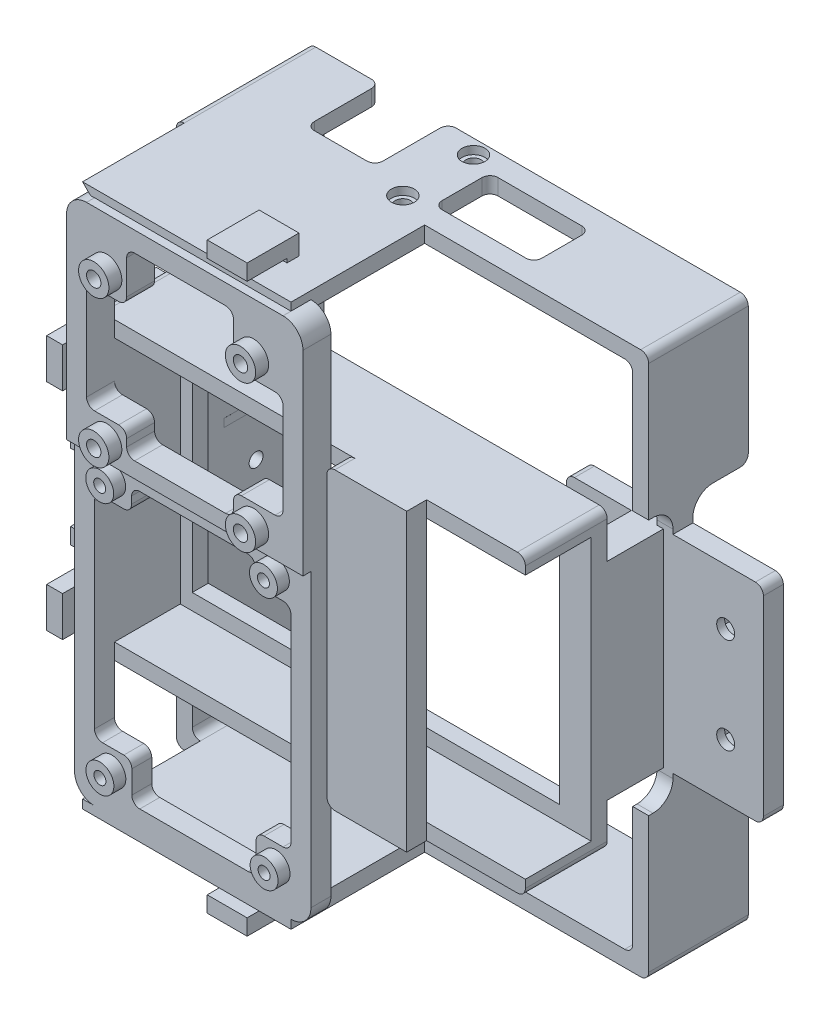
from build123d import *

# Parameters (mm, degrees)
BOSS_EXTRUDE1_DEPTH      = 3.695048
BOSS_EXTRUDE1_DEPTH_BACK = 21.278005
SKETCH1_W                = 0.01
SKETCH1_H                = 2
SKETCH3_W                = 24.973053222
SKETCH3_H                = 128.156000146
BOSS_EXTRUDE2_DEPTH      = 4
SKETCH4_R                = 1.9
SKETCH4_W                = 25
SKETCH4_H                = 14
BOSS_EXTRUDE3_DEPTH      = 4
BOSS_EXTRUDE4_START      = 4
SKETCH8_R                = 1.9
SKETCH8_W                = 25
SKETCH8_H                = 14
BOSS_EXTRUDE4_DEPTH      = 4
BOSS_EXTRUDE5_DEPTH      = 24.973053221
BOSS_EXTRUDE6_START      = 0.5
BOSS_EXTRUDE6_DEPTH      = 5
FILLET2_R                = 5
FILLET3_R                = 5
FILLET4_R                = 5
FILLET5_R                = 5
FILLET6_R                = 2
FILLET7_R                = 2
FILLET8_R                = 2
FILLET9_R                = 2
SKETCH11_R               = 2.25
CUT_EXTRUDE1_DEPTH       = 5
CUT_EXTRUDE2_DEPTH       = 3
SKETCH14_R               = 1.75
CUT_EXTRUDE6_DEPTH       = 4
SKETCH15_R               = 2.875
CUT_EXTRUDE7_DEPTH       = 2
CUT_EXTRUDE8_START       = -2
SKETCH16_R               = 2.875
CUT_EXTRUDE8_DEPTH       = 2
BOSS_EXTRUDE7_START      = 8
BOSS_EXTRUDE7_DEPTH      = 8
BOSS_EXTRUDE8_DEPTH      = 28.5
SKETCH19_W               = 52.25
SKETCH19_H               = 2.188820213
BOSS_EXTRUDE9_DEPTH      = 5
SKETCH20_W               = 8
SKETCH20_H               = 51.865848188
BOSS_EXTRUDE10_DEPTH     = 14.086526611
BOSS_EXTRUDE11_DEPTH     = 10
BOSS_EXTRUDE12_DEPTH     = 4
CUT_EXTRUDE11_START      = -1
SKETCH25_W               = 2
SKETCH25_H               = 19.5
CUT_EXTRUDE11_DEPTH      = 47.5
JOIN1_START              = 11.695048456
JOIN1_DEPTH              = 20.5
JOIN1_START_2            = 32.195048456
JOIN1_2_DEPTH            = 5
JOIN1_3_OUTLINE_W        = 103
JOIN1_3_OUTLINE_H        = 66
JOIN1_3_OUTLINE_W_2      = 42
JOIN1_3_OUTLINE_H_2      = 58
JOIN1_3_DEPTH            = 4
JOIN1_START_3            = 35.195048456
JOIN1_4_OUTLINE_R        = 3.5
JOIN1_4_OUTLINE_R_2      = 1.5
JOIN1_4_DEPTH            = 4
JOIN1_START_4            = 37.195048456
JOIN1_5_OUTLINE_R        = 3.800000663
JOIN1_5_OUTLINE_R_2      = 1.800000663
JOIN1_5_DEPTH            = 5.25
JOIN1_START_5            = 39.195048456
JOIN1_6_OUTLINE_R        = 3.5
JOIN1_6_OUTLINE_R_2      = 1.5
JOIN1_6_DEPTH            = 1
SKETCH26_W               = 3
SKETCH26_H               = 10
BOSS_EXTRUDE13_DEPTH     = 5
SKETCH27_W               = 4
SKETCH27_H               = 10
BOSS_EXTRUDE14_DEPTH     = 10
SKETCH28_W               = 10
SKETCH28_H               = 3
BOSS_EXTRUDE15_DEPTH     = 5
SKETCH29_W               = 10
SKETCH29_H               = 3
BOSS_EXTRUDE16_DEPTH     = 5
SKETCH30_W               = 10
SKETCH30_H               = 4
BOSS_EXTRUDE17_DEPTH     = 10


# Read off the part's stored shape, not the designer's step: Join1
with BuildPart() as part:
    # Sketch1 → Boss-Extrude1 (new, two sides: drawn at the far end of the back side and taken through both)
    with BuildSketch(Plane.XY.offset(-BOSS_EXTRUDE1_DEPTH_BACK)):
        with Locations((81.095003321, 0.501)):
            Rectangle(SKETCH1_W, SKETCH1_H)
    extrude(amount=BOSS_EXTRUDE1_DEPTH + BOSS_EXTRUDE1_DEPTH_BACK)

    # Sketch3 → Boss-Extrude2 (add)
    with BuildSketch(Plane.ZY.offset(-81.090003321)):
        with Locations((-8.791478155, 0.501)):
            Rectangle(SKETCH3_W, SKETCH3_H)
    extrude(amount=BOSS_EXTRUDE2_DEPTH)

    # Sketch4 → Boss-Extrude3 (add)
    with BuildSketch(Plane.XZ.offset(63.577000073)):
        Polygon((77.090003321, -21.278004766), (77.090003321, 3.695048456), (171.572794191, 3.695048456), (171.572794191, -21.278004766), (112.241426774, -21.278004766), (112.241426774, -2.941478155), (95.058571688, -2.941478155), (95.058571688, -21.278004766), align=None)
        with Locations((122.241426774, 0.058521845)):
            Circle(SKETCH4_R, mode=Mode.SUBTRACT)
        with Locations((122.241426774, -17.641478155)):
            Circle(SKETCH4_R, mode=Mode.SUBTRACT)
        with Locations((140.741426774, -8.791478155)):
            Rectangle(SKETCH4_W, SKETCH4_H, mode=Mode.SUBTRACT)
    extrude(amount=BOSS_EXTRUDE3_DEPTH)

    # Sketch8 → Boss-Extrude4 (add)
    with BuildSketch(Plane(origin=(0, 64.579000073, 0), x_dir=(1, 0, 0), z_dir=(0, 1, 0)).offset(BOSS_EXTRUDE4_START)):
        Polygon((95.058571688, 21.278004766), (77.090003321, 21.278004766), (77.090003321, -3.695048456), (171.572794191, -3.695048456), (171.572794191, 21.278004766), (112.241426774, 21.278004766), (112.241426774, 2.941478155), (95.058571688, 2.941478155), align=None)
        with Locations((122.241426774, 17.641478155)):
            Circle(SKETCH8_R, mode=Mode.SUBTRACT)
        with Locations((122.241426774, -0.058521845)):
            Circle(SKETCH8_R, mode=Mode.SUBTRACT)
        with Locations((140.741426774, 8.791478155)):
            Rectangle(SKETCH8_W, SKETCH8_H, mode=Mode.SUBTRACT)
    extrude(amount=-BOSS_EXTRUDE4_DEPTH)

    # Sketch9 → Boss-Extrude5 (add)
    with BuildSketch(Plane.XY.offset(3.695048456)):
        Polygon((171.572794191, -67.577000073), (187.487825359, -67.577000073), (187.487825359, -31.577000073), (183.487825359, -31.577000073), (183.487825359, -63.577000073), (171.572794191, -63.577000073), align=None)
        Polygon((183.487825359, 32.579000073), (187.487825359, 32.579000073), (187.487825359, 68.579000073), (171.572794191, 68.579000073), (171.572794191, 64.579000073), (183.487825359, 64.579000073), align=None)
    extrude(amount=-BOSS_EXTRUDE5_DEPTH)

    # Sketch10 → Boss-Extrude6 (add)
    with BuildSketch(Plane.XY.offset(-7.891478155).offset(BOSS_EXTRUDE6_START)):
        Polygon((160.809135524, -25.431924094), (160.809135524, 26.433924094), (183.487825359, 26.433924094), (183.487825359, 32.579000073), (187.487825359, 32.579000073), (187.487825359, 26.433924094), (210.166515194, 26.433924094), (210.166515194, -25.431924094), (187.487825359, -25.431924094), (187.487825359, -31.577000073), (183.487825359, -31.577000073), (183.487825359, -25.431924094), align=None)
    extrude(amount=BOSS_EXTRUDE6_DEPTH)

    # Fillet2
    fillet2_edges = [part.edges().sort_by_distance(p)[0] for p in [
        (185.487825359, -31.577000073, -2.391478155),
    ]]
    fillet(fillet2_edges, radius=FILLET2_R)

    # Fillet3
    fillet3_edges = [part.edges().sort_by_distance(p)[0] for p in [
        (185.487825359, -31.577000073, -7.391478155),
    ]]
    fillet(fillet3_edges, radius=FILLET3_R)

    # Fillet4
    fillet4_edges = [part.edges().sort_by_distance(p)[0] for p in [
        (185.487825359, 32.579000073, -7.391478155),
    ]]
    fillet(fillet4_edges, radius=FILLET4_R)

    # Fillet5
    fillet5_edges = [part.edges().sort_by_distance(p)[0] for p in [
        (185.487825359, 32.579000073, -2.391478155),
    ]]
    fillet(fillet5_edges, radius=FILLET5_R)

    # Fillet6
    fillet6_edges = [part.edges().sort_by_distance(p)[0] for p in [
        (160.809135524, -25.431924094, -4.891478155),
        (210.166515194, -25.431924094, -4.891478155),
        (210.166515194, 26.433924094, -4.891478155),
        (160.809135524, 26.433924094, -4.891478155),
    ]]
    fillet(fillet6_edges, radius=FILLET6_R)

    # Fillet7
    fillet7_edges = [part.edges().sort_by_distance(p)[0] for p in [
        (187.487825359, -67.577000073, -8.791478155),
        (185.487825359, -31.577000073, -21.278004765),
        (187.487825359, 68.579000073, -8.791478155),
        (185.487825359, 32.579000073, -21.278004765),
    ]]
    fillet(fillet7_edges, radius=FILLET7_R)

    # Fillet8
    fillet8_edges = [part.edges().sort_by_distance(p)[0] for p in [
        (183.487825359, -63.577000073, -8.791478155),
        (183.487825359, 64.579000073, -8.791478155),
        (81.090003321, 64.579000073, -8.791478155),
        (81.090003321, -63.577000073, -8.791478155),
        (77.090003321, -67.577000073, -8.791478155),
        (77.090003321, 68.579000073, -8.791478155),
    ]]
    fillet(fillet8_edges, radius=FILLET8_R)

    # Fillet9
    fillet9_edges = [part.edges().sort_by_distance(p)[0] for p in [
        (95.058571688, -65.577000073, -21.278004766),
        (95.058571688, -65.577000073, -2.941478155),
        (112.241426774, -65.577000073, -2.941478155),
        (112.241426774, -65.577000073, -21.278004766),
        (128.241426774, -65.577000073, -1.791478155),
        (128.241426774, -65.577000073, -15.791478155),
        (153.241426774, -65.577000073, -15.791478155),
        (153.241426774, -65.577000073, -1.791478155),
        (112.241426774, 66.579000073, -21.278004766),
        (112.241426774, 66.579000073, -2.941478155),
        (95.058571688, 66.579000073, -2.941478155),
        (95.058571688, 66.579000073, -21.278004766),
        (153.241426774, 66.579000073, -1.791478155),
        (153.241426774, 66.579000073, -15.791478155),
        (128.241426774, 66.579000073, -15.791478155),
        (128.241426774, 66.579000073, -1.791478155),
    ]]
    fillet(fillet9_edges, radius=FILLET9_R)

    # Sketch11 → Cut-Extrude1 (cut)
    with BuildSketch(Plane.XY.offset(-2.391478155)):
        with Locations((170.268989638, -11.499)):
            Circle(SKETCH11_R)
        with Locations((170.268989638, 12.501)):
            Circle(SKETCH11_R)
        with Locations((200.706661081, -11.499)):
            Circle(SKETCH11_R)
        with Locations((200.706661081, 12.501)):
            Circle(SKETCH11_R)
    extrude(amount=-CUT_EXTRUDE1_DEPTH, mode=Mode.SUBTRACT)

    # Sketch12 → Cut-Extrude2 (cut)
    with BuildSketch(Plane(origin=(0, 0, -7.391478155), x_dir=(-1, 0, 0), z_dir=(0, 0, -1))):
        Polygon((-203.356661081, -13.028978213), (-203.356661081, -9.969021787), (-200.706661081, -8.439043573), (-198.056661081, -9.969021787), (-198.056661081, -13.028978213), (-200.706661081, -14.558956427), align=None)
        Polygon((-203.356661081, 10.971021787), (-203.356661081, 14.030978213), (-200.706661081, 15.560956427), (-198.056661081, 14.030978213), (-198.056661081, 10.971021787), (-200.706661081, 9.441043573), align=None)
        Polygon((-172.918989638, -13.028978213), (-172.918989638, -9.969021787), (-170.268989638, -8.439043573), (-167.618989638, -9.969021787), (-167.618989638, -13.028978213), (-170.268989638, -14.558956427), align=None)
        Polygon((-172.918989638, 10.971021787), (-172.918989638, 14.030978213), (-170.268989638, 15.560956427), (-167.618989638, 14.030978213), (-167.618989638, 10.971021787), (-170.268989638, 9.441043573), align=None)
    extrude(amount=-CUT_EXTRUDE2_DEPTH, mode=Mode.SUBTRACT)

    # Sketch14 → Cut-Extrude6 (cut)
    with BuildSketch(Plane.ZY.offset(-77.090003321)):
        with Locations(Location((-15.304951544, -11.499, 0), (0, 0, 270))):
            Circle(SKETCH14_R)
        with Locations(Location((-15.304951544, 12.501, 0), (0, 0, 270))):
            Circle(SKETCH14_R)
        with Locations(Location((-4.304951544, -11.499, 0), (0, 0, 270))):
            Circle(SKETCH14_R)
        with Locations(Location((-4.304951544, 12.501, 0), (0, 0, 270))):
            Circle(SKETCH14_R)
    extrude(amount=-CUT_EXTRUDE6_DEPTH, mode=Mode.SUBTRACT)

    # Sketch15 → Cut-Extrude7 (cut)
    with BuildSketch(Plane.XZ.offset(67.577000073)):
        with Locations((122.241426774, 0.058521845)):
            Circle(SKETCH15_R)
        with Locations((122.241426774, -17.641478155)):
            Circle(SKETCH15_R)
    extrude(amount=-CUT_EXTRUDE7_DEPTH, mode=Mode.SUBTRACT)

    # Sketch16 → Cut-Extrude8 (cut)
    with BuildSketch(Plane(origin=(0, 68.579000073, 0), x_dir=(1, 0, 0), z_dir=(0, 1, 0)).offset(CUT_EXTRUDE8_START)):
        with Locations((122.241426774, 17.641478155)):
            Circle(SKETCH16_R)
        with Locations((122.241426774, -0.058521845)):
            Circle(SKETCH16_R)
    extrude(amount=CUT_EXTRUDE8_DEPTH, mode=Mode.SUBTRACT)

    # Sketch17 → Boss-Extrude7 (add)
    with BuildSketch(Plane.XY.offset(3.695048456).offset(BOSS_EXTRUDE7_START)):
        with BuildLine():
            Line((83.090003321, -63.577000073), (79.090003321, -67.577000073))
            ThreePointArc((79.090003321, -67.577000073), (77.675789759, -66.991213635), (77.090003321, -65.577000073))
            Line((77.090003321, -65.577000073), (77.090003321, 66.579000073))
            ThreePointArc((77.090003321, 66.579000073), (77.675789759, 67.993213635), (79.090003321, 68.579000073))
            Line((79.090003321, 68.579000073), (83.090003321, 64.579000073))
            ThreePointArc((83.090003321, 64.579000073), (81.675789759, 63.993213635), (81.090003321, 62.579000073))
            Line((81.090003321, 62.579000073), (81.090003321, 1.501))
            Line((81.090003321, 1.501), (81.090003321, -0.499))
            Line((81.090003321, -0.499), (81.090003321, -61.577000073))
            ThreePointArc((81.090003321, -61.577000073), (81.675789759, -62.991213635), (83.090003321, -63.577000073))
        make_face()
    extrude(amount=-BOSS_EXTRUDE7_DEPTH)

    # Sketch18 → Boss-Extrude8 (add)
    with BuildSketch(Plane.XY.offset(3.695048456)):
        Polygon((131.340003321, 68.579000073), (131.340003321, 64.579000073), (83.090003321, 64.579000073), (79.090003321, 68.579000073), align=None)
        Polygon((79.090003321, -67.577000073), (83.090003321, -63.577000073), (131.340003321, -63.577000073), (131.340003321, -67.577000073), align=None)
    extrude(amount=BOSS_EXTRUDE8_DEPTH)

    # Sketch19 → Boss-Extrude9 (add)
    with BuildSketch(Plane.XY.offset(32.195048456)):
        Polygon((131.340003321, 68.579000073), (79.090003321, 68.579000073), (81.090003321, 66.579000073), (131.340003321, 66.579000073), align=None)
        with Locations((105.215003321, -66.482589967)):
            Rectangle(SKETCH19_W, SKETCH19_H)
    extrude(amount=BOSS_EXTRUDE9_DEPTH)

    # Sketch20 → Boss-Extrude10 (add)
    with BuildSketch(Plane.XY.offset(-2.391478155)):
        with Locations((181.090003321, 0.501)):
            Rectangle(SKETCH20_W, SKETCH20_H)
    extrude(amount=BOSS_EXTRUDE10_DEPTH)

    # Sketch21 → Boss-Extrude11 (add)
    with BuildSketch(Plane.ZY.offset(-77.090003321)):
        Polygon((2.695048456, 24.75), (2.695048456, -24.75), (24.195048456, -24.75), (24.195048456, -23.75), (24.195048456, -22.75), (4.695048456, -22.75), (4.695048456, 22.75), (24.195048456, 22.75), (24.195048456, 23.75), (24.195048456, 24.75), align=None)
    extrude(amount=BOSS_EXTRUDE11_DEPTH)

    # Sketch22 → Boss-Extrude12 (add)
    with BuildSketch(Plane.ZY.offset(-67.090003321)):
        with BuildLine():
            Line((24.195048456, -24.75), (2.695048456, -24.75))
            Line((2.695048456, -24.75), (2.695048456, 24.75))
            Line((2.695048456, 24.75), (24.195048456, 24.75))
            Line((24.195048456, 24.75), (24.195048456, 20.75))
            Line((24.195048456, 20.75), (15.195048456, 20.75))
            ThreePointArc((15.195048456, 20.75), (6.695048456, 12.25), (15.195048456, 3.75))
            Line((15.195048456, 3.75), (24.195048456, 3.75))
            Line((24.195048456, 3.75), (24.195048456, -3.75))
            Line((24.195048456, -3.75), (15.195048456, -3.75))
            ThreePointArc((15.195048456, -3.75), (6.695048456, -12.25), (15.195048456, -20.75))
            Line((15.195048456, -20.75), (24.195048456, -20.75))
            Line((24.195048456, -20.75), (24.195048456, -24.75))
        make_face()
    extrude(amount=BOSS_EXTRUDE12_DEPTH)

    # Sketch25 → Cut-Extrude11 (cut)
    with BuildSketch(Plane.XZ.offset(-22.75).offset(CUT_EXTRUDE11_START)):
        with Locations((71.090003321, 14.445048456)):
            Rectangle(SKETCH25_W, SKETCH25_H)
    extrude(amount=CUT_EXTRUDE11_DEPTH, mode=Mode.SUBTRACT)

    # Join1 outline → Join1 (add)
    with BuildSketch(Plane.XY.offset(JOIN1_START)):
        with BuildLine():
            ThreePointArc((77.090003321, -34.32267986), (77.675789759, -35.736893422), (79.090003321, -36.32267986))
            Line((79.090003321, -36.32267986), (183.090003321, -36.32267986))
            ThreePointArc((183.090003321, -36.32267986), (184.504216883, -35.736893422), (185.090003321, -34.32267986))
            Line((185.090003321, -34.32267986), (185.090003321, -32.32267986))
            Line((185.090003321, -32.32267986), (82.090003321, -32.32267986))
            Line((82.090003321, -32.32267986), (82.090003321, 33.67732014))
            Line((82.090003321, 33.67732014), (185.090003321, 33.67732014))
            Line((185.090003321, 33.67732014), (185.090003321, 35.67732014))
            ThreePointArc((185.090003321, 35.67732014), (184.504216884, 37.091533703), (183.090003321, 37.67732014))
            Line((183.090003321, 37.67732014), (79.090003321, 37.67732014))
            ThreePointArc((79.090003321, 37.67732014), (77.675789759, 37.091533703), (77.090003321, 35.67732014))
            Line((77.090003321, 35.67732014), (77.090003321, -34.32267986))
        make_face()
    extrude(amount=JOIN1_DEPTH)

    # Join1 2 outline → Join1 2 (add)
    # profile 1 of 2: a face of its own
    with BuildSketch(Plane.XY.offset(JOIN1_START_2)):
        with BuildLine():
            ThreePointArc((77.090003321, -60.38817986), (78.554469415, -63.923713766), (82.090003321, -65.38817986))
            Line((82.090003321, -65.38817986), (131.340003321, -65.38817986))
            ThreePointArc((131.340003321, -65.38817986), (134.875537227, -63.923713766), (136.340003321, -60.38817986))
            Line((136.340003321, -60.38817986), (136.340003321, 61.61182014))
            ThreePointArc((136.340003321, 61.61182014), (134.875537227, 65.147354046), (131.340003321, 66.61182014))
            Line((131.340003321, 66.61182014), (82.090003321, 66.61182014))
            ThreePointArc((82.090003321, 66.61182014), (81.803559317, 66.60360838), (81.518056196, 66.579000073))
            ThreePointArc((81.518056196, 66.579000073), (78.357729508, 64.939000957), (77.090003321, 61.61182014))
            Line((77.090003321, 61.61182014), (77.090003321, -60.38817986))
        make_face()
        with BuildLine():
            Line((82.090003321, -48.68817986), (82.090003321, 0.74282014))
            ThreePointArc((82.090003321, 0.74282014), (82.675789759, 2.157033703), (84.090003321, 2.74282014))
            Line((84.090003321, 2.74282014), (89.392003321, 2.74282014))
            ThreePointArc((89.392003321, 2.74282014), (90.806216883, 3.328606578), (91.392003321, 4.74282014))
            Line((91.392003321, 4.74282014), (91.392003321, 6.525000079))
            ThreePointArc((91.392003321, 6.525000079), (91.977789759, 7.939213642), (93.392003321, 8.525000079))
            Line((93.392003321, 8.525000079), (120.434003321, 8.525000079))
            ThreePointArc((120.434003321, 8.525000079), (121.848216884, 7.939213642), (122.434003321, 6.525000079))
            Line((122.434003321, 6.525000079), (122.434003321, 4.70582014))
            ThreePointArc((122.434003321, 4.70582014), (123.019789759, 3.291606578), (124.434003321, 2.70582014))
            Line((124.434003321, 2.70582014), (129.340003321, 2.70582014))
            ThreePointArc((129.340003321, 2.70582014), (130.754216884, 2.120033703), (131.340003321, 0.70582014))
            Line((131.340003321, 0.70582014), (131.340003321, -48.68817986))
            ThreePointArc((131.340003321, -48.68817986), (130.754216883, -50.102393422), (129.340003321, -50.68817986))
            Line((129.340003321, -50.68817986), (124.590003321, -50.68817986))
            ThreePointArc((124.590003321, -50.68817986), (123.175789759, -51.273966298), (122.590003321, -52.68817986))
            Line((122.590003321, -52.68817986), (122.590003321, -58.38817986))
            ThreePointArc((122.590003321, -58.38817986), (122.004216883, -59.802393423), (120.590003321, -60.38817986))
            Line((120.590003321, -60.38817986), (93.440003321, -60.38817986))
            ThreePointArc((93.440003321, -60.38817986), (92.025789759, -59.802393422), (91.440003321, -58.38817986))
            Line((91.440003321, -58.38817986), (91.440003321, -52.68817986))
            ThreePointArc((91.440003321, -52.68817986), (90.854216884, -51.273966297), (89.440003321, -50.68817986))
            Line((89.440003321, -50.68817986), (84.090003321, -50.68817986))
            ThreePointArc((84.090003321, -50.68817986), (82.675789759, -50.102393422), (82.090003321, -48.68817986))
        make_face(mode=Mode.SUBTRACT)
        Polygon((89.315003321, -54.028297836), (89.315003321, -57.348061884), (86.440003321, -59.007943908), (83.565003321, -57.348061884), (83.565003321, -54.028297836), (86.440003321, -52.368415812), align=None, mode=Mode.SUBTRACT)
        Polygon((127.590003321, -52.368415812), (130.465003321, -54.028297836), (130.465003321, -57.348061884), (127.590003321, -59.007943908), (124.715003321, -57.348061884), (124.715003321, -54.028297836), align=None, mode=Mode.SUBTRACT)
        with BuildLine():
            ThreePointArc((82.090003321, 47.11182014), (82.675789759, 48.526033703), (84.090003321, 49.11182014))
            Line((84.090003321, 49.11182014), (90.144627644, 49.11182014))
            ThreePointArc((90.144627644, 49.11182014), (91.558841207, 49.697606577), (92.144627644, 51.11182014))
            Line((92.144627644, 51.11182014), (92.144627644, 59.61182014))
            ThreePointArc((92.144627644, 59.61182014), (92.730414082, 61.026033703), (94.144627644, 61.61182014))
            Line((94.144627644, 61.61182014), (116.934003321, 61.61182014))
            ThreePointArc((116.934003321, 61.61182014), (118.348216884, 61.026033703), (118.934003321, 59.61182014))
            Line((118.934003321, 59.61182014), (118.934003321, 51.11182014))
            ThreePointArc((118.934003321, 51.11182014), (119.519789759, 49.697606578), (120.934003321, 49.11182014))
            Line((120.934003321, 49.11182014), (129.340003321, 49.11182014))
            ThreePointArc((129.340003321, 49.11182014), (130.754216884, 48.526033703), (131.340003321, 47.11182014))
            Line((131.340003321, 47.11182014), (131.340003321, 24.344180019))
            ThreePointArc((131.340003321, 24.344180019), (130.754216884, 22.929966456), (129.340003321, 22.344180019))
            Line((129.340003321, 22.344180019), (120.934003321, 22.344180019))
            ThreePointArc((120.934003321, 22.344180019), (119.519789759, 21.758393581), (118.934003321, 20.344180019))
            Line((118.934003321, 20.344180019), (118.934003321, 18.525000079))
            ThreePointArc((118.934003321, 18.525000079), (118.348216884, 17.110786517), (116.934003321, 16.525000079))
            Line((116.934003321, 16.525000079), (94.144627644, 16.525000079))
            ThreePointArc((94.144627644, 16.525000079), (92.730414082, 17.110786517), (92.144627644, 18.525000079))
            Line((92.144627644, 18.525000079), (92.144627644, 20.344180019))
            ThreePointArc((92.144627644, 20.344180019), (91.558841207, 21.758393582), (90.144627644, 22.344180019))
            Line((90.144627644, 22.344180019), (84.090003321, 22.344180019))
            ThreePointArc((84.090003321, 22.344180019), (82.675789759, 22.929966456), (82.090003321, 24.344180019))
            Line((82.090003321, 24.344180019), (82.090003321, 47.11182014))
        make_face(mode=Mode.SUBTRACT)
        Polygon((83.517003321, 9.402702164), (86.392003321, 11.062584188), (89.267003321, 9.402702164), (89.267003321, 6.082938116), (86.392003321, 4.423056092), (83.517003321, 6.082938116), align=None, mode=Mode.SUBTRACT)
        Polygon((127.434003321, 11.025584188), (130.309003321, 9.365702164), (130.309003321, 6.045938116), (127.434003321, 4.386056092), (124.559003321, 6.045938116), (124.559003321, 9.365702164), align=None, mode=Mode.SUBTRACT)
        Polygon((126.584003321, 55.641798354), (126.584003321, 52.581841927), (123.934003321, 51.051863713), (121.284003321, 52.581841927), (121.284003321, 55.641798354), (123.934003321, 57.171776567), align=None, mode=Mode.SUBTRACT)
        Polygon((84.494627644, 55.641798354), (87.144627644, 57.171776567), (89.794627644, 55.641798354), (89.794627644, 52.581841927), (87.144627644, 51.051863713), (84.494627644, 52.581841927), align=None, mode=Mode.SUBTRACT)
        Polygon((84.494627644, 18.874158232), (87.144627644, 20.404136445), (89.794627644, 18.874158232), (89.794627644, 15.814201805), (87.144627644, 14.284223592), (84.494627644, 15.814201805), align=None, mode=Mode.SUBTRACT)
        Polygon((121.284003321, 18.874158232), (123.934003321, 20.404136445), (126.584003321, 18.874158232), (126.584003321, 15.814201805), (123.934003321, 14.284223592), (121.284003321, 15.814201805), align=None, mode=Mode.SUBTRACT)
    # profile 2 of 2: a face of its own
    with BuildSketch(Plane.XY.offset(JOIN1_START_2)):
        with BuildLine():
            ThreePointArc((140.340003321, -34.32267986), (140.925789759, -35.736893422), (142.340003321, -36.32267986))
            Line((142.340003321, -36.32267986), (160.340003321, -36.32267986))
            Line((160.340003321, -36.32267986), (160.340003321, 37.67732014))
            Line((160.340003321, 37.67732014), (142.340003321, 37.67732014))
            ThreePointArc((142.340003321, 37.67732014), (140.925789759, 37.091533703), (140.340003321, 35.67732014))
            Line((140.340003321, 35.67732014), (140.340003321, -34.32267986))
        make_face()
    extrude(amount=JOIN1_2_DEPTH)

    # Join1 3 outline → Join1 3 (add)
    with BuildSketch(Plane.XY.offset(JOIN1_START)):
        with Locations((133.590003321, 0.67732014)):
            Rectangle(JOIN1_3_OUTLINE_W, JOIN1_3_OUTLINE_H)
        with Locations((106.090003321, 0.67732014)):
            Rectangle(JOIN1_3_OUTLINE_W_2, JOIN1_3_OUTLINE_H_2, mode=Mode.SUBTRACT)
        with Locations((156.090003321, 0.67732014)):
            Rectangle(JOIN1_3_OUTLINE_W_2, JOIN1_3_OUTLINE_H_2, mode=Mode.SUBTRACT)
    extrude(amount=JOIN1_3_DEPTH)

    # Join1 4 outline → Join1 4 (add)
    # profile 1 of 5: a face of its own
    with BuildSketch(Plane.XY.offset(JOIN1_START_3)):
        with BuildLine():
            Line((77.090003321, 12.61182014), (136.340003321, 12.61182014))
            Line((136.340003321, 12.61182014), (136.340003321, 61.61182014))
            ThreePointArc((136.340003321, 61.61182014), (134.875537227, 65.147354046), (131.340003321, 66.61182014))
            Line((131.340003321, 66.61182014), (82.090003321, 66.61182014))
            ThreePointArc((82.090003321, 66.61182014), (81.803559317, 66.60360838), (81.518056196, 66.579000073))
            ThreePointArc((81.518056196, 66.579000073), (78.357729508, 64.939000957), (77.090003321, 61.61182014))
            Line((77.090003321, 61.61182014), (77.090003321, 12.61182014))
        make_face()
        with BuildLine():
            ThreePointArc((82.090003321, 47.11182014), (82.675789759, 48.526033703), (84.090003321, 49.11182014))
            Line((84.090003321, 49.11182014), (90.144627644, 49.11182014))
            ThreePointArc((90.144627644, 49.11182014), (91.558841207, 49.697606577), (92.144627644, 51.11182014))
            Line((92.144627644, 51.11182014), (92.144627644, 59.61182014))
            ThreePointArc((92.144627644, 59.61182014), (92.730414082, 61.026033703), (94.144627644, 61.61182014))
            Line((94.144627644, 61.61182014), (116.934003321, 61.61182014))
            ThreePointArc((116.934003321, 61.61182014), (118.348216884, 61.026033703), (118.934003321, 59.61182014))
            Line((118.934003321, 59.61182014), (118.934003321, 51.11182014))
            ThreePointArc((118.934003321, 51.11182014), (119.519789759, 49.697606578), (120.934003321, 49.11182014))
            Line((120.934003321, 49.11182014), (129.340003321, 49.11182014))
            ThreePointArc((129.340003321, 49.11182014), (130.754216884, 48.526033703), (131.340003321, 47.11182014))
            Line((131.340003321, 47.11182014), (131.340003321, 24.344180019))
            ThreePointArc((131.340003321, 24.344180019), (130.754216884, 22.929966456), (129.340003321, 22.344180019))
            Line((129.340003321, 22.344180019), (120.934003321, 22.344180019))
            ThreePointArc((120.934003321, 22.344180019), (119.519789759, 21.758393581), (118.934003321, 20.344180019))
            Line((118.934003321, 20.344180019), (118.934003321, 18.525000079))
            ThreePointArc((118.934003321, 18.525000079), (118.348216884, 17.110786517), (116.934003321, 16.525000079))
            Line((116.934003321, 16.525000079), (94.144627644, 16.525000079))
            ThreePointArc((94.144627644, 16.525000079), (92.730414082, 17.110786517), (92.144627644, 18.525000079))
            Line((92.144627644, 18.525000079), (92.144627644, 20.344180019))
            ThreePointArc((92.144627644, 20.344180019), (91.558841207, 21.758393582), (90.144627644, 22.344180019))
            Line((90.144627644, 22.344180019), (84.090003321, 22.344180019))
            ThreePointArc((84.090003321, 22.344180019), (82.675789759, 22.929966456), (82.090003321, 24.344180019))
            Line((82.090003321, 24.344180019), (82.090003321, 47.11182014))
        make_face(mode=Mode.SUBTRACT)
        Polygon((126.584003321, 55.641798354), (126.584003321, 52.581841927), (123.934003321, 51.051863713), (121.284003321, 52.581841927), (121.284003321, 55.641798354), (123.934003321, 57.171776567), align=None, mode=Mode.SUBTRACT)
        Polygon((84.494627644, 55.641798354), (87.144627644, 57.171776567), (89.794627644, 55.641798354), (89.794627644, 52.581841927), (87.144627644, 51.051863713), (84.494627644, 52.581841927), align=None, mode=Mode.SUBTRACT)
        Polygon((84.494627644, 18.874158232), (87.144627644, 20.404136445), (89.794627644, 18.874158232), (89.794627644, 15.814201805), (87.144627644, 14.284223592), (84.494627644, 15.814201805), align=None, mode=Mode.SUBTRACT)
        Polygon((121.284003321, 18.874158232), (123.934003321, 20.404136445), (126.584003321, 18.874158232), (126.584003321, 15.814201805), (123.934003321, 14.284223592), (121.284003321, 15.814201805), align=None, mode=Mode.SUBTRACT)
    # profile 2 of 5: a face of its own
    with BuildSketch(Plane.XY.offset(JOIN1_START_3)):
        with Locations((86.392003321, 7.74282014)):
            Circle(JOIN1_4_OUTLINE_R)
        with Locations((86.392003321, 7.74282014)):
            Circle(JOIN1_4_OUTLINE_R_2, mode=Mode.SUBTRACT)
    # profile 3 of 5: a face of its own
    with BuildSketch(Plane.XY.offset(JOIN1_START_3)):
        with Locations((127.434003321, 7.70582014)):
            Circle(JOIN1_4_OUTLINE_R)
        with Locations((127.434003321, 7.70582014)):
            Circle(JOIN1_4_OUTLINE_R_2, mode=Mode.SUBTRACT)
    # profile 4 of 5: a face of its own
    with BuildSketch(Plane.XY.offset(JOIN1_START_3)):
        with Locations((127.590003321, -55.68817986)):
            Circle(JOIN1_4_OUTLINE_R)
        with Locations((127.590003321, -55.68817986)):
            Circle(JOIN1_4_OUTLINE_R_2, mode=Mode.SUBTRACT)
    # profile 5 of 5: a face of its own
    with BuildSketch(Plane.XY.offset(JOIN1_START_3)):
        with Locations((86.440003321, -55.68817986)):
            Circle(JOIN1_4_OUTLINE_R)
        with Locations((86.440003321, -55.68817986)):
            Circle(JOIN1_4_OUTLINE_R_2, mode=Mode.SUBTRACT)
    extrude(amount=JOIN1_4_DEPTH)

    # Join1 5 outline → Join1 5 (add)
    # profile 1 of 4: a face of its own
    with BuildSketch(Plane.XY.offset(JOIN1_START_4)):
        with Locations((87.144627644, 17.344180019)):
            Circle(JOIN1_5_OUTLINE_R)
        with Locations((87.144627644, 17.344180019)):
            Circle(JOIN1_5_OUTLINE_R_2, mode=Mode.SUBTRACT)
    # profile 2 of 4: a face of its own
    with BuildSketch(Plane.XY.offset(JOIN1_START_4)):
        with Locations((123.934003321, 17.344180019)):
            Circle(JOIN1_5_OUTLINE_R)
        with Locations((123.934003321, 17.344180019)):
            Circle(JOIN1_5_OUTLINE_R_2, mode=Mode.SUBTRACT)
    # profile 3 of 4: a face of its own
    with BuildSketch(Plane.XY.offset(JOIN1_START_4)):
        with Locations((87.144627644, 54.11182014)):
            Circle(JOIN1_5_OUTLINE_R)
        with Locations((87.144627644, 54.11182014)):
            Circle(JOIN1_5_OUTLINE_R_2, mode=Mode.SUBTRACT)
    # profile 4 of 4: a face of its own
    with BuildSketch(Plane.XY.offset(JOIN1_START_4)):
        with Locations((123.934003321, 54.11182014)):
            Circle(JOIN1_5_OUTLINE_R)
        with Locations((123.934003321, 54.11182014)):
            Circle(JOIN1_5_OUTLINE_R_2, mode=Mode.SUBTRACT)
    extrude(amount=JOIN1_5_DEPTH)

    # Join1 6 outline → Join1 6 (add)
    # profile 1 of 4: a face of its own
    with BuildSketch(Plane.XY.offset(JOIN1_START_5)):
        with Locations((86.392003321, 7.74282014)):
            Circle(JOIN1_6_OUTLINE_R)
        with Locations((86.392003321, 7.74282014)):
            Circle(JOIN1_6_OUTLINE_R_2, mode=Mode.SUBTRACT)
    # profile 2 of 4: a face of its own
    with BuildSketch(Plane.XY.offset(JOIN1_START_5)):
        with Locations((127.434003321, 7.70582014)):
            Circle(JOIN1_6_OUTLINE_R)
        with Locations((127.434003321, 7.70582014)):
            Circle(JOIN1_6_OUTLINE_R_2, mode=Mode.SUBTRACT)
    # profile 3 of 4: a face of its own
    with BuildSketch(Plane.XY.offset(JOIN1_START_5)):
        with Locations((127.590003321, -55.68817986)):
            Circle(JOIN1_6_OUTLINE_R)
        with Locations((127.590003321, -55.68817986)):
            Circle(JOIN1_6_OUTLINE_R_2, mode=Mode.SUBTRACT)
    # profile 4 of 4: a face of its own
    with BuildSketch(Plane.XY.offset(JOIN1_START_5)):
        with Locations((86.440003321, -55.68817986)):
            Circle(JOIN1_6_OUTLINE_R)
        with Locations((86.440003321, -55.68817986)):
            Circle(JOIN1_6_OUTLINE_R_2, mode=Mode.SUBTRACT)
    extrude(amount=JOIN1_6_DEPTH)

    # Sketch26 → Boss-Extrude13 (add)
    with BuildSketch(Plane.ZY.offset(-77.090003321)):
        with Locations((27.695048456, 27.67732014)):
            Rectangle(SKETCH26_W, SKETCH26_H)
        with Locations((27.695048456, -26.32267986)):
            Rectangle(SKETCH26_W, SKETCH26_H)
    extrude(amount=BOSS_EXTRUDE13_DEPTH)

    # Sketch27 → Boss-Extrude14 (add)
    with BuildSketch(Plane.XY.offset(29.195048456)):
        with Locations((74.090003321, 27.67732014)):
            Rectangle(SKETCH27_W, SKETCH27_H)
        with Locations((74.090003321, -26.32267986)):
            Rectangle(SKETCH27_W, SKETCH27_H)
    extrude(amount=BOSS_EXTRUDE14_DEPTH)

    # Sketch28 → Boss-Extrude15 (add)
    with BuildSketch(Plane.XZ.offset(67.577000073)):
        with Locations((117.340003321, 27.695048456)):
            Rectangle(SKETCH28_W, SKETCH28_H)
    extrude(amount=BOSS_EXTRUDE15_DEPTH)

    # Sketch29 → Boss-Extrude16 (add)
    with BuildSketch(Plane(origin=(0, 68.579000073, 0), x_dir=(1, 0, 0), z_dir=(0, 1, 0))):
        with Locations((117.340003321, -27.695048456)):
            Rectangle(SKETCH29_W, SKETCH29_H)
    extrude(amount=BOSS_EXTRUDE16_DEPTH)

    # Sketch30 → Boss-Extrude17 (add)
    with BuildSketch(Plane.XY.offset(29.195048456)):
        with Locations((117.340003321, 71.579000073)):
            Rectangle(SKETCH30_W, SKETCH30_H)
        with Locations((117.340003321, -70.577000073)):
            Rectangle(SKETCH30_W, SKETCH30_H)
    extrude(amount=BOSS_EXTRUDE17_DEPTH)


solid = part.part
